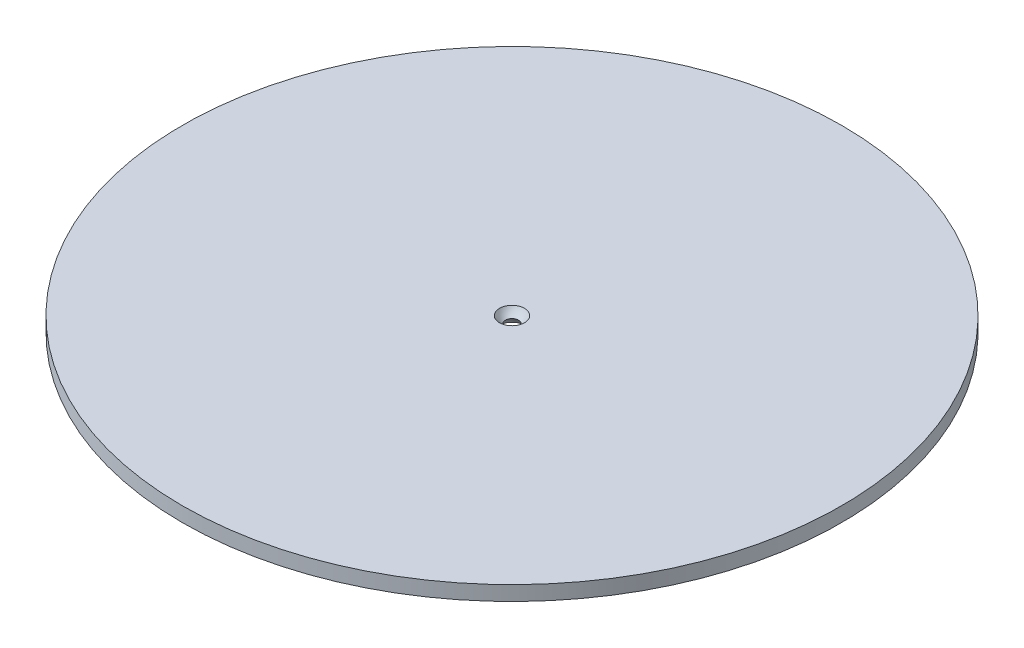
from build123d import *

# Parameters (mm, degrees)
SKETCH1_R           = 1125
BOSS_EXTRUDE1_DEPTH = 50


with BuildPart() as part:
    # Sketch1 → Boss-Extrude1 (new body)
    with BuildSketch(Plane(origin=(0, 0, 0), x_dir=(1, 0, 0), z_dir=(0, 1, 0))):
        Circle(SKETCH1_R)
    extrude(amount=BOSS_EXTRUDE1_DEPTH)

    # Sketch2 → Cut-Revolve1 (revolve, cut)
    with BuildSketch(Plane.XY):
        with BuildLine():
            Line((0, 0), (0, 50))
            Line((0, 50), (42.704112888, 50))
            ThreePointArc((42.704112888, 50), (33.952555247, 36.459958096), (22.281337432, 25.337675478))
            ThreePointArc((22.281337432, 25.337675478), (34.122583246, 13.982542532), (42.704112888, 0))
            Line((42.704112888, 0), (0, 0))
        make_face()
    revolve(axis=Axis((0, 0, 0), (0, 1, 0)), mode=Mode.SUBTRACT)


solid = part.part
